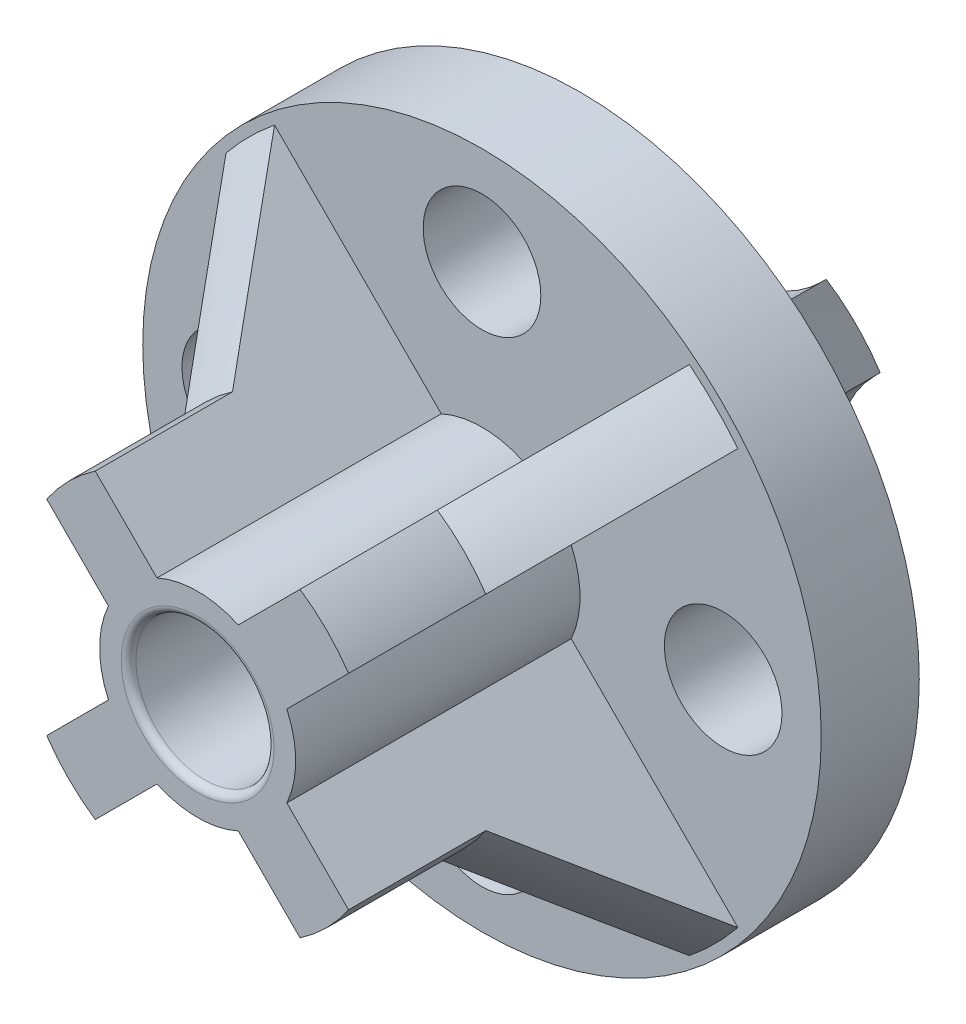
from build123d import *
from build123d.topology import SkipClean

# Parameters (mm, degrees)
SKETCH2_R           = 33.6
SKETCH2_R_2         = 2
SKETCH2_R_3         = 6
BOSS_EXTRUDE1_DEPTH = 10
BOSS_EXTRUDE2_START = 15
BOSS_EXTRUDE2_DEPTH = 15
CIRPATTERN1_COUNT   = 4
SKETCH4_R           = 10
BOSS_EXTRUDE3_DEPTH = 29
SKETCH5_R           = 34.6
SKETCH5_R_2         = 33.6
BOSS_EXTRUDE5_DEPTH = 10
BOSS_EXTRUDE6_START = 4
SKETCH6_R           = 8
SKETCH6_R_2         = 2
BOSS_EXTRUDE6_DEPTH = 4
BOSS_EXTRUDE7_DEPTH = 15
CIRPATTERN2_COUNT   = 4
CHAMFER1_SIZE       = 15
CHAMFER2_SIZE       = 15
BOSS_EXTRUDE8_DEPTH = 14
CUT_EXTRUDE1_START  = -7
SKETCH10_R          = 7.05
CUT_EXTRUDE1_DEPTH  = 7
FILLET1_R           = 0.75


with BuildPart() as part:
    # Sketch2 → Boss-Extrude1 (new body)
    with BuildSketch(Plane.XY):
        Circle(SKETCH2_R)
        Circle(SKETCH2_R_2, mode=Mode.SUBTRACT)
        with Locations((0, 24.6)):
            Circle(SKETCH2_R_3, mode=Mode.SUBTRACT)
        with Locations((0, -24.6)):
            Circle(SKETCH2_R_3, mode=Mode.SUBTRACT)
        with Locations((-24.6, 0)):
            Circle(SKETCH2_R_3, mode=Mode.SUBTRACT)
        with Locations((24.6, 0)):
            Circle(SKETCH2_R_3, mode=Mode.SUBTRACT)
    extrude(amount=BOSS_EXTRUDE1_DEPTH)

    # Sketch3 → Boss-Extrude2 (add)
    with BuildSketch(Plane(origin=(0, 0, 0), x_dir=(-1, 0, 0), z_dir=(0, 0, -1)).offset(BOSS_EXTRUDE2_START)):
        with BuildLine():
            Line((-8, 0), (-11.1, 0))
            ThreePointArc((-11.1, 0), (-12.127626311, -5.166226337), (-15.054058454, -9.545941546))
            Line((-15.054058454, -9.545941546), (-26.352684728, -20.84456782))
            ThreePointArc((-26.352684728, -20.84456782), (-23.758787848, -23.758787848), (-20.84456782, -26.352684728))
            Line((-20.84456782, -26.352684728), (-9.545941546, -15.054058454))
            ThreePointArc((-9.545941546, -15.054058454), (-5.166226337, -12.127626311), (0, -11.1))
            Line((0, -11.1), (0, -8))
            ThreePointArc((0, -8), (-5.656854249, -5.656854249), (-8, 0))
        make_face()
    boss_extrude2 = extrude(amount=-BOSS_EXTRUDE2_DEPTH)

    # CirPattern1: Boss-Extrude2 ×4 about axis
    with SkipClean():  # the faces are left unmerged after this step: merging them gives an invalid solid
        cirpattern1_axis = Axis((0, 0, 0), (0, 0, 1))
        for i in range(1, CIRPATTERN1_COUNT):
            add(boss_extrude2.rotate(cirpattern1_axis, i * 360 / CIRPATTERN1_COUNT))

    # Sketch4 → Boss-Extrude3 (add)
    with SkipClean():  # the faces are left unmerged after this step: merging them gives an invalid solid
        with BuildSketch(Plane.XY.offset(10)):
            with Locations(Location((0, 0, 0), (0, 0, 180))):
                Circle(SKETCH4_R)
            with BuildLine():
                Line((-3.619392214, 6.05), (3.619392214, 6.05))
                ThreePointArc((3.619392214, 6.05), (0, -7.05), (-3.619392214, 6.05))
            make_face(mode=Mode.SUBTRACT)
        extrude(amount=BOSS_EXTRUDE3_DEPTH)

    # Sketch5 → Boss-Extrude5 (add)
    with BuildSketch(Plane(origin=(0, 0, 0), x_dir=(-1, 0, 0), z_dir=(0, 0, -1))):
        Circle(SKETCH5_R)
        Circle(SKETCH5_R_2, mode=Mode.SUBTRACT)
    extrude(amount=-BOSS_EXTRUDE5_DEPTH)

    # Sketch6 → Boss-Extrude6 (add)
    with SkipClean():  # the faces are left unmerged after this step: merging them gives an invalid solid
        with BuildSketch(Plane(origin=(0, 0, 0), x_dir=(-1, 0, 0), z_dir=(0, 0, -1)).offset(BOSS_EXTRUDE6_START)):
            with Locations(Location((0, 0, 0), (0, 0, 180))):
                Circle(SKETCH6_R)
            Circle(SKETCH6_R_2, mode=Mode.SUBTRACT)
        extrude(amount=-BOSS_EXTRUDE6_DEPTH)

    # Sketch8 → Boss-Extrude7 (add)
    with SkipClean():  # the faces are left unmerged after this step: merging them gives an invalid solid
        with BuildSketch(Plane.XY.offset(10)):
            with BuildLine():
                Line((21.154662867, -26.104410336), (4.148946916, -9.098694384))
                ThreePointArc((4.148946916, -9.098694384), (7.071067812, -7.071067812), (9.098694384, -4.148946916))
                Line((9.098694384, -4.148946916), (26.104410336, -21.154662867))
                ThreePointArc((26.104410336, -21.154662867), (23.758787848, -23.758787848), (21.154662867, -26.104410336))
            make_face()
        boss_extrude7 = extrude(amount=BOSS_EXTRUDE7_DEPTH)

    # CirPattern2: Boss-Extrude7 ×4 about axis
    with SkipClean():  # the faces are left unmerged after this step: merging them gives an invalid solid
        cirpattern2_axis = Axis((0, 0, 0), (0, 0, 1))
        for i in range(1, CIRPATTERN2_COUNT):
            add(boss_extrude7.rotate(cirpattern2_axis, i * 360 / CIRPATTERN2_COUNT))

    # Chamfer1
    chamfer1_edges = [part.edges().sort_by_distance(p)[0] for p in [
        (23.758787848, 23.758787848, -15),
        (23.758787848, -23.758787848, -15),
        (-23.758787848, -23.758787848, -15),
        (-23.758787848, 23.758787848, -15),
    ]]
    chamfer(chamfer1_edges, length=CHAMFER1_SIZE - 0.0001)  # a hair under: the kernel refuses the full size

    # Chamfer2
    chamfer2_edges = [part.edges().sort_by_distance(p)[0] for p in [
        (23.758787848, -23.758787848, 25),
        (-23.758787848, -23.758787848, 25),
        (-23.758787848, 23.758787848, 25),
        (23.758787848, 23.758787848, 25),
    ]]
    chamfer(chamfer2_edges, length=CHAMFER2_SIZE - 0.0001)  # a hair under: the kernel refuses the full size

    # Sketch9 → Boss-Extrude8 (add)
    with BuildSketch(Plane.XY.offset(25)):
        with BuildLine():
            Line((4.148946916, 9.098694384), (10.442362812, 15.392110281))
            ThreePointArc((10.442362812, 15.392110281), (13.15218613, 13.15218613), (15.392110281, 10.442362812))
            Line((15.392110281, 10.442362812), (9.098694384, 4.148946916))
            ThreePointArc((9.098694384, 4.148946916), (7.071067812, 7.071067812), (4.148946916, 9.098694384))
        make_face()
        with BuildLine():
            Line((10.442362812, -15.392110281), (4.148946916, -9.098694384))
            ThreePointArc((4.148946916, -9.098694384), (7.071067812, -7.071067812), (9.098694384, -4.148946916))
            Line((9.098694384, -4.148946916), (15.392110281, -10.442362812))
            ThreePointArc((15.392110281, -10.442362812), (13.15218613, -13.15218613), (10.442362812, -15.392110281))
        make_face()
        with BuildLine():
            Line((-15.392110281, -10.442362812), (-9.098694384, -4.148946916))
            ThreePointArc((-9.098694384, -4.148946916), (-7.071067812, -7.071067812), (-4.148946916, -9.098694384))
            Line((-4.148946916, -9.098694384), (-10.442362812, -15.392110281))
            ThreePointArc((-10.442362812, -15.392110281), (-13.15218613, -13.15218613), (-15.392110281, -10.442362812))
        make_face()
        with BuildLine():
            Line((-15.392110281, 10.442362812), (-9.098694384, 4.148946916))
            ThreePointArc((-9.098694384, 4.148946916), (-7.071067812, 7.071067812), (-4.148946916, 9.098694384))
            Line((-4.148946916, 9.098694384), (-10.442362812, 15.392110281))
            ThreePointArc((-10.442362812, 15.392110281), (-13.15218613, 13.15218613), (-15.392110281, 10.442362812))
        make_face()
    extrude(amount=BOSS_EXTRUDE8_DEPTH)

    # Sketch10 → Cut-Extrude1 (cut)
    with SkipClean():  # the faces are left unmerged after this step: merging them gives an invalid solid
        with BuildSketch(Plane.XY.offset(39).offset(CUT_EXTRUDE1_START)):
            with Locations(Location((0, 0, 0), (0, 0, 120.889831942))):
                Circle(SKETCH10_R)
        extrude(amount=CUT_EXTRUDE1_DEPTH, mode=Mode.SUBTRACT)

    # Fillet1
    fillet1_edges = [part.edges().sort_by_distance(p)[0] for p in [
        (8, 0, -15),
        (0, -7.05, 39),
    ]]
    fillet(fillet1_edges, radius=FILLET1_R)


solid = part.part
